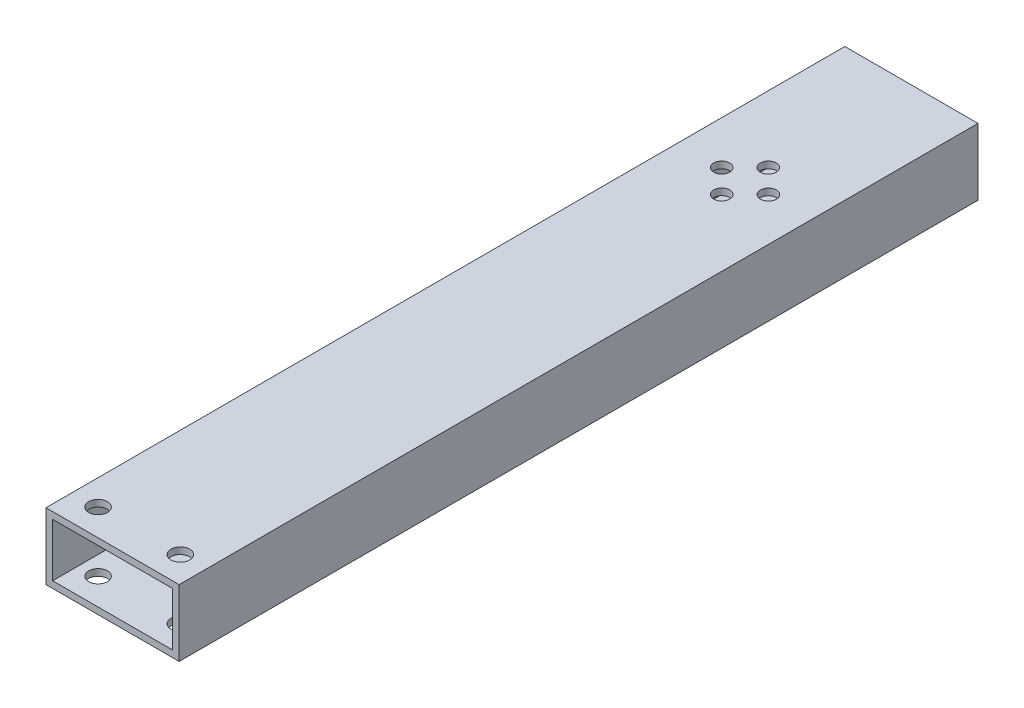
from build123d import *

# Parameters (mm, degrees)
SKETCH1_W               = 25.4
SKETCH1_H               = 12.7
BOSS_EXTRUDE1_DEPTH     = 127
SKETCH4_W               = 22.86
SKETCH4_H               = 10.16
CUT_EXTRUDE1_DEPTH      = 128.791284914
CUT_EXTRUDE2_DEPTH      = 129.263712717
CUT_EXTRUDE2_DEPTH_BACK = 129.263712717
SKETCH5_R               = 1.7907
CUT_EXTRUDE3_DEPTH      = 129.263712717
CUT_EXTRUDE3_DEPTH_BACK = 129.263712717
SKETCH6_R               = 1.524
SKETCH7_W               = 25.4
SKETCH7_H               = 12.7
SKETCH7_W_2             = 22.86
SKETCH7_H_2             = 10.16
BOSS_EXTRUDE2_DEPTH     = 25.4


with BuildPart() as part:
    # Sketch1 → Boss-Extrude1 (new body)
    with BuildSketch(Plane.XY):
        Rectangle(SKETCH1_W, SKETCH1_H)
    extrude(amount=BOSS_EXTRUDE1_DEPTH)

    # Sketch4 → Cut-Extrude1 (cut, through all)
    with BuildSketch(Plane(origin=(0, 0, 0), x_dir=(-1, 0, 0), z_dir=(0, 0, -1))):
        Rectangle(SKETCH4_W, SKETCH4_H)
    extrude(amount=-CUT_EXTRUDE1_DEPTH, mode=Mode.SUBTRACT)

    # Sketch5 → Cut-Extrude2 (cut, two sides: drawn at the far end of the back side and taken through both)
    with BuildSketch(Plane(origin=(0, 6.35, 0), x_dir=(1, 0, 0), z_dir=(0, 1, 0)).offset(-CUT_EXTRUDE2_DEPTH_BACK)):
        with Locations((-7.8486, -121.92)):
            Circle(SKETCH5_R)
        with Locations((7.8486, -121.92)):
            Circle(SKETCH5_R)
    extrude(amount=CUT_EXTRUDE2_DEPTH + CUT_EXTRUDE2_DEPTH_BACK, mode=Mode.SUBTRACT)

    # Sketch6 → Cut-Extrude3 (cut, two sides: drawn at the far end of the back side and taken through both)
    with BuildSketch(Plane(origin=(0, -6.35, 0), x_dir=(-1, 0, 0), z_dir=(0, -1, 0)).offset(-CUT_EXTRUDE3_DEPTH_BACK)):
        with Locations((4.445, -6.35)):
            Circle(SKETCH6_R)
        with Locations((-4.4704, -6.35)):
            Circle(SKETCH6_R)
        with Locations((0, -1.905)):
            Circle(SKETCH6_R)
        with Locations((0, -10.795)):
            Circle(SKETCH6_R)
    extrude(amount=CUT_EXTRUDE3_DEPTH + CUT_EXTRUDE3_DEPTH_BACK, mode=Mode.SUBTRACT)

    # Sketch7 → Boss-Extrude2 (add)
    with BuildSketch(Plane(origin=(0, 0, 0), x_dir=(-1, 0, 0), z_dir=(0, 0, -1))):
        Rectangle(SKETCH7_W, SKETCH7_H)
        Rectangle(SKETCH7_W_2, SKETCH7_H_2, mode=Mode.SUBTRACT)
    extrude(amount=BOSS_EXTRUDE2_DEPTH)


solid = part.part
